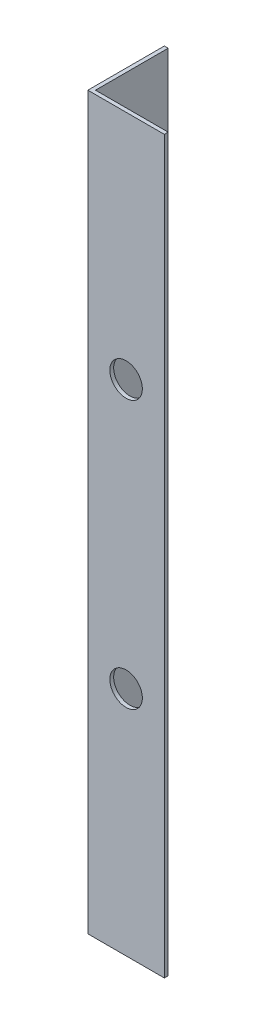
from build123d import *

# Parameters (mm, degrees)
EXTRUDE_1_DEPTH     = 191
SKETCH_2_R          = 4.25
CUT_EXTRUDE_1_DEPTH = 194.082883757


with BuildPart() as part:
    # Эскиз1 → Бобышка-Вытянуть1 (new body)
    with BuildSketch(Plane(origin=(0, 0, 0), x_dir=(1, 0, 0), z_dir=(0, 1, 0))):
        Polygon((0, 0), (0, 20), (1, 20), (1, 1), (20, 1), (20, 0), align=None)
    extrude(amount=EXTRUDE_1_DEPTH)

    # Эскиз2 → Вырез-Вытянуть1 (cut, through all)
    with BuildSketch(Plane.XY):
        with Locations((10, 130.5)):
            Circle(SKETCH_2_R)
        with Locations((10, 60.5)):
            Circle(SKETCH_2_R)
    extrude(amount=-CUT_EXTRUDE_1_DEPTH, mode=Mode.SUBTRACT)


solid = part.part
